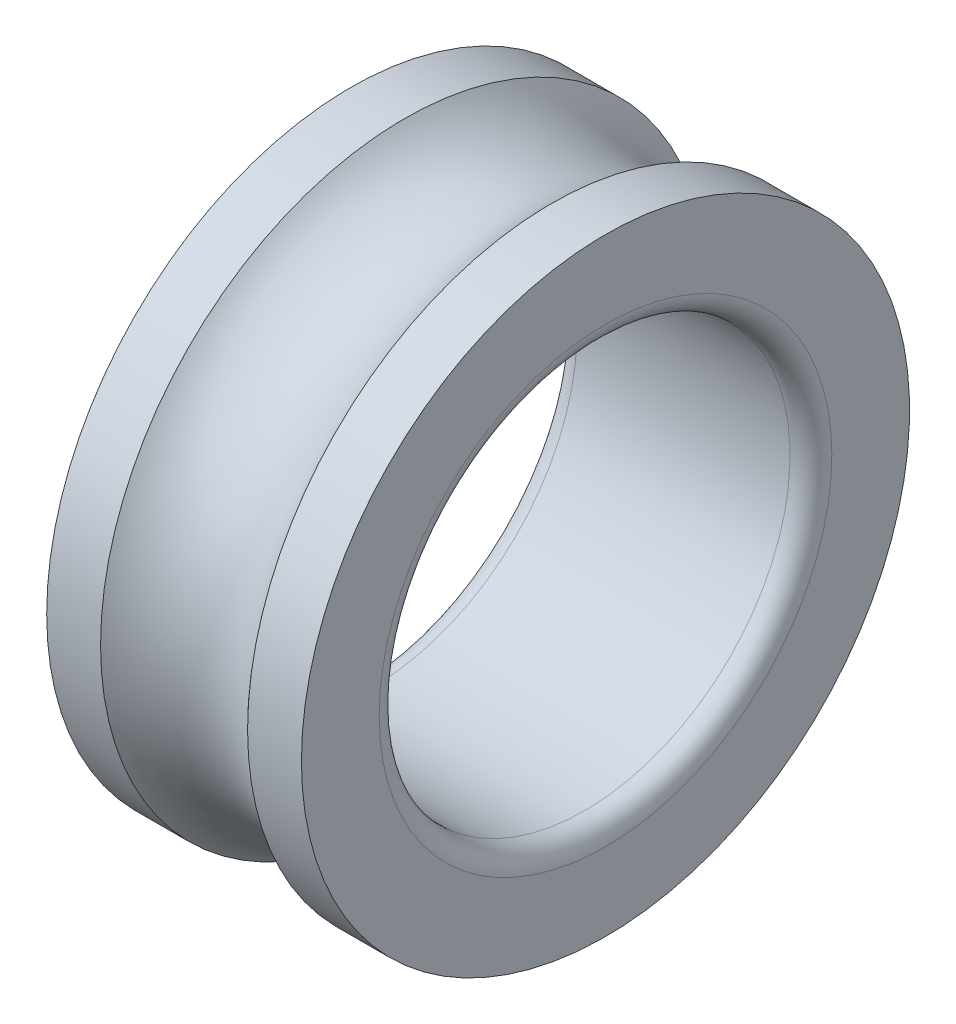
from build123d import *

# Parameters (mm, degrees)
SCALE1_SCALE = 0.193040386


with BuildPart() as part:
    # Sketch1 → Revolve1 (revolve)
    with BuildSketch(Plane.XY):
        with BuildLine():
            Line((-15.5, 37), (-8.94427191, 37))
            ThreePointArc((-8.94427191, 37), (0, 33), (8.94427191, 37))
            Line((8.94427191, 37), (15.5, 37))
            Line((15.5, 37), (15.5, 27.54))
            ThreePointArc((15.5, 27.54), (14.756051224, 25.743948776), (12.96, 25))
            Line((12.96, 25), (-12.96, 25))
            ThreePointArc((-12.96, 25), (-14.756051224, 25.743948776), (-15.5, 27.54))
            Line((-15.5, 27.54), (-15.5, 37))
        make_face()
    revolve(axis=Axis((-21.666666667, 0, 0), (1, 0, 0)))


with BuildPart() as part_1:
    # Scale1: scaled about (0, 0, 0)
    add(part.part.scale(SCALE1_SCALE))


solid = part_1.part
